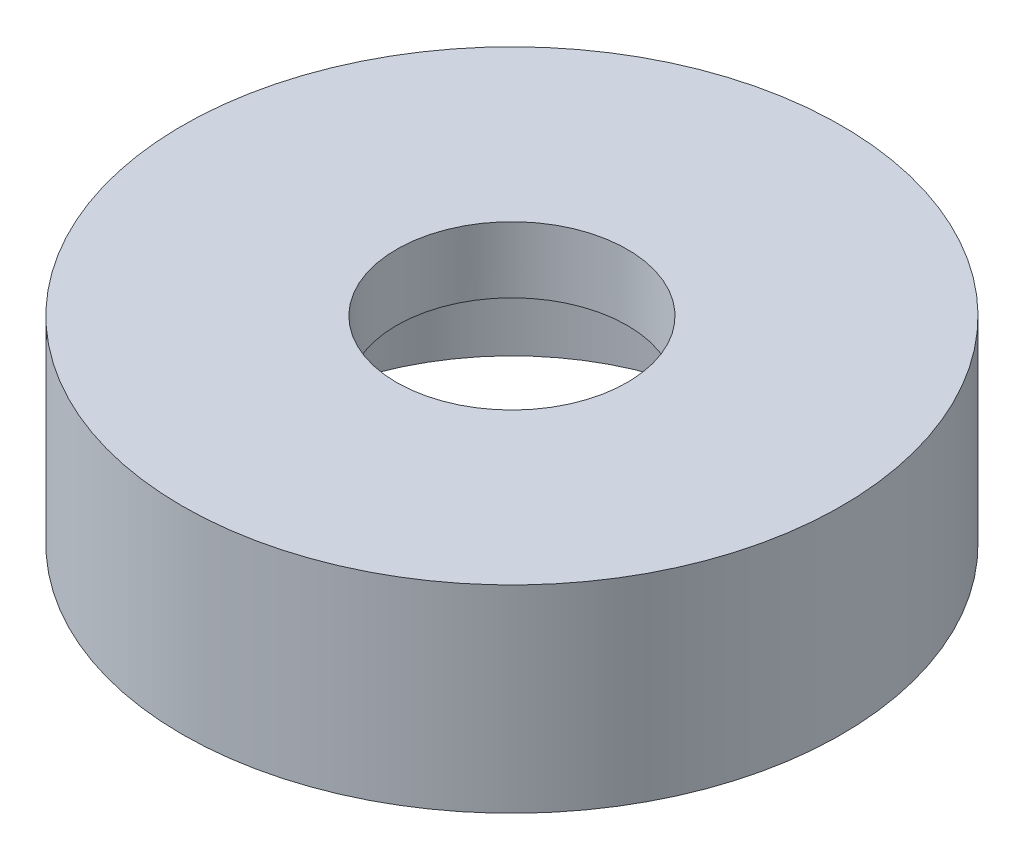
from build123d import *

# Parameters (mm, degrees)
SKETCH_1_R          = 20
EXTRUDE_1_DEPTH     = 12
SKETCH_3_R          = 14
CUT_EXTRUDE_3_DEPTH = 8
SKETCH_4_R          = 7
CUT_EXTRUDE_4_DEPTH = 31.724582991


with BuildPart() as part:
    # Эскиз1 → Вытянуть1 (new body)
    with BuildSketch(Plane(origin=(0, 0, 0), x_dir=(1, 0, 0), z_dir=(0, 1, 0))):
        Circle(SKETCH_1_R)
    extrude(amount=EXTRUDE_1_DEPTH)

    # Эскиз3 → Вытянуть3 (cut)
    with BuildSketch(Plane.XZ):
        Circle(SKETCH_3_R)
    extrude(amount=-CUT_EXTRUDE_3_DEPTH, mode=Mode.SUBTRACT)

    # Эскиз4 → Вытянуть4 (cut, through all)
    with BuildSketch(Plane(origin=(0, 12, 0), x_dir=(1, 0, 0), z_dir=(0, 1, 0))):
        Circle(SKETCH_4_R)
    extrude(amount=-CUT_EXTRUDE_4_DEPTH, mode=Mode.SUBTRACT)


solid = part.part
